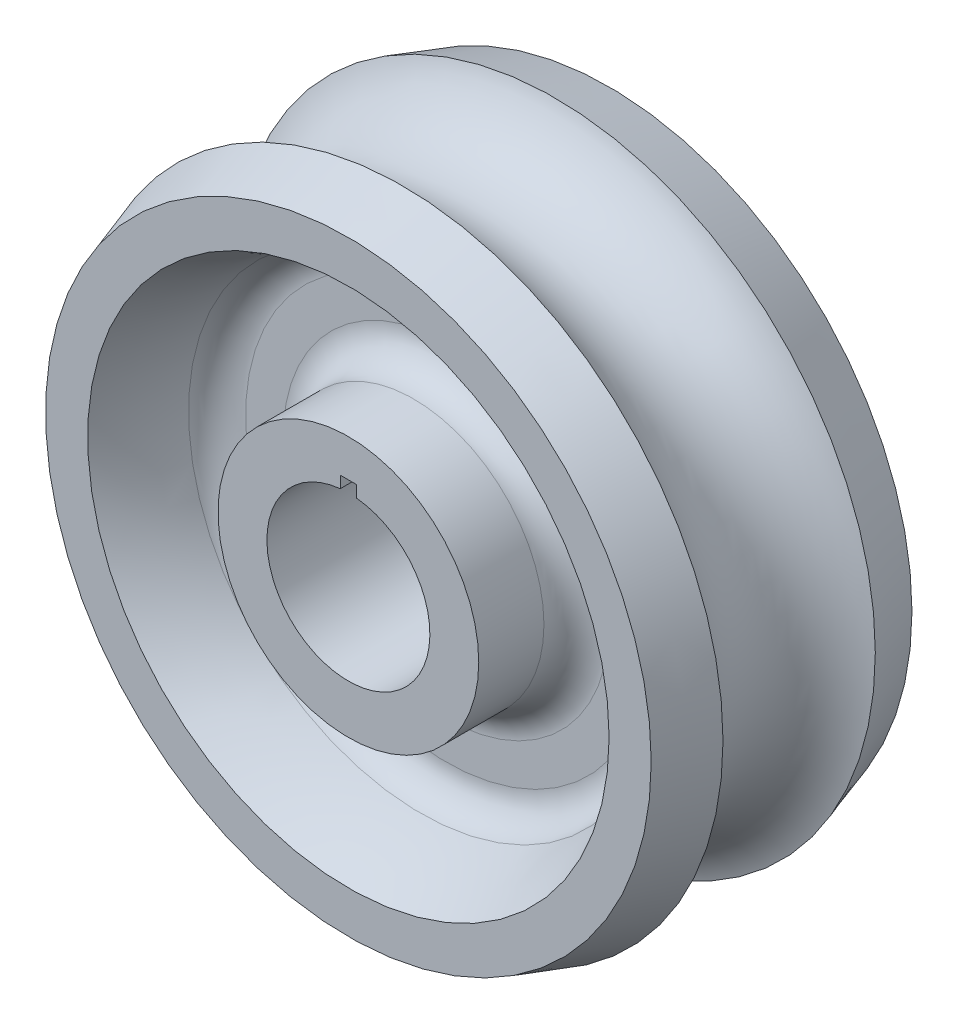
from build123d import *

# Parameters (mm, degrees)
CUT_EXTRUDE1_DEPTH = 51.928528947


with BuildPart() as part:
    # Sketch1 → Base-Revolve (revolve)
    with BuildSketch(Plane(origin=(0, 0, 0), x_dir=(0, 0, -1), z_dir=(1, 0, 0))):
        with BuildLine():
            Line((-12.7, 7.9375), (12.7, 7.9375))
            Line((12.7, 7.9375), (12.7, 12.7))
            Line((12.7, 12.7), (6.35, 12.7))
            ThreePointArc((6.35, 12.7), (4.10493597, 13.62993597), (3.175, 15.875))
            Line((3.175, 15.875), (3.175, 19.536533326))
            ThreePointArc((3.175, 19.536533326), (3.867988327, 21.516493693), (5.644444444, 22.632145763))
            ThreePointArc((5.644444444, 22.632145763), (9.276039821, 23.751430753), (12.7, 25.4))
            Line((12.7, 25.4), (12.7, 29.5021))
            Line((12.7, 29.5021), (7.418151002, 31.213419075))
            ThreePointArc((7.418151002, 31.213419075), (0, 25.8191), (-7.418151002, 31.213419075))
            Line((-7.418151002, 31.213419075), (-12.7, 29.5021))
            Line((-12.7, 29.5021), (-12.7, 25.4))
            ThreePointArc((-12.7, 25.4), (-9.276039821, 23.751430753), (-5.644444444, 22.632145763))
            ThreePointArc((-5.644444444, 22.632145763), (-3.867988327, 21.516493693), (-3.175, 19.536533326))
            Line((-3.175, 19.536533326), (-3.175, 15.875))
            ThreePointArc((-3.175, 15.875), (-4.10493597, 13.62993597), (-6.35, 12.7))
            Line((-6.35, 12.7), (-12.7, 12.7))
            Line((-12.7, 12.7), (-12.7, 7.9375))
        make_face()
    revolve(axis=Axis((0, 0, 0), (0, 0, -1)))

    # Sketch2 → Cut-Extrude1 (cut, through all)
    with BuildSketch(Plane.XY.offset(12.7)):
        with BuildLine():
            Line((-0.79375, 7.897712782), (-0.79375, 9.0424))
            Line((-0.79375, 9.0424), (0.79375, 9.0424))
            Line((0.79375, 9.0424), (0.79375, 7.897712782))
            ThreePointArc((0.79375, 7.897712782), (0, 7.9375), (-0.79375, 7.897712782))
        make_face()
    extrude(amount=-CUT_EXTRUDE1_DEPTH, mode=Mode.SUBTRACT)


solid = part.part
